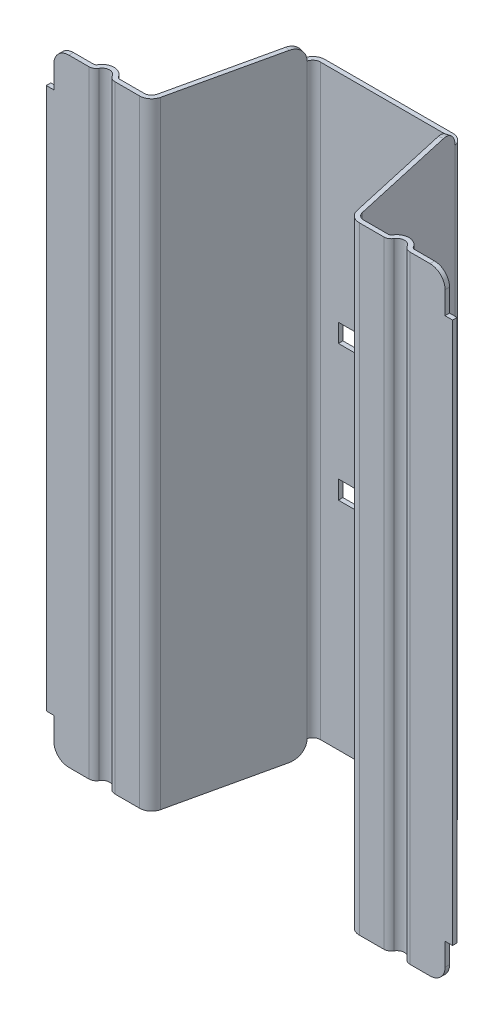
from build123d import *

# Parameters (mm, degrees)
EXTRUDE_THIN1_DEPTH = 20.5
EXTRUDE1_DEPTH      = 41
EXTRUDE2_DEPTH      = 1
FILLET1_R           = 1
EXTRUDE3_DEPTH      = 1
FILLET2_R           = 1
SKETCH5_W           = 6.1
SKETCH5_H           = 1.22
EXTRUDE4_DEPTH      = 45.5


with BuildPart() as part:
    # Sketch1 → Extrude-Thin1 (new, symmetric)
    with BuildSketch(Plane(origin=(0, 0, 0), x_dir=(1, 0, 0), z_dir=(0, 1, 0))):
        with BuildLine():
            Line((13.5, 0), (10.666025404, 0))
            ThreePointArc((10.666025404, 0), (10.416025404, 0.066987298), (10.233012702, 0.25))
            ThreePointArc((10.233012702, 0.25), (9.8, 0.5), (9.366987298, 0.25))
            ThreePointArc((9.366987298, 0.25), (9.183974596, 0.066987298), (8.933974596, 0))
            Line((8.933974596, 0), (7.3, 0))
            ThreePointArc((7.3, 0), (6.800019439, 0.175484637), (6.519386146, 0.624951403))
            Line((6.519386146, 0.624951403), (4.737883659, 8.569405373))
            ThreePointArc((4.737883659, 8.569405373), (4.56248785, 8.850322102), (4.25, 8.96))
            Line((4.25, 8.96), (-4.25, 8.96))
            ThreePointArc((-4.25, 8.96), (-4.56248785, 8.850322102), (-4.737883659, 8.569405373))
            Line((-4.737883659, 8.569405373), (-6.519386146, 0.624951403))
            ThreePointArc((-6.519386146, 0.624951403), (-6.800019439, 0.175484637), (-7.3, 0))
            Line((-7.3, 0), (-8.933974596, 0))
            ThreePointArc((-8.933974596, 0), (-9.183974596, 0.066987298), (-9.366987298, 0.25))
            ThreePointArc((-9.366987298, 0.25), (-9.8, 0.5), (-10.233012702, 0.25))
            ThreePointArc((-10.233012702, 0.25), (-10.416025404, 0.066987298), (-10.666025404, 0))
            Line((-10.666025404, 0), (-13.5, 0))
            Line((-13.5, 0), (-13.5, 0.3))
            Line((-13.5, 0.3), (-10.666025404, 0.3))
            ThreePointArc((-10.666025404, 0.3), (-10.566025404, 0.326794919), (-10.492820323, 0.4))
            ThreePointArc((-10.492820323, 0.4), (-9.8, 0.8), (-9.107179677, 0.4))
            ThreePointArc((-9.107179677, 0.4), (-9.033974596, 0.326794919), (-8.933974596, 0.3))
            Line((-8.933974596, 0.3), (-7.3, 0.3))
            ThreePointArc((-7.3, 0.3), (-6.98751215, 0.409677898), (-6.812116341, 0.690594627))
            Line((-6.812116341, 0.690594627), (-5.030613854, 8.635048597))
            ThreePointArc((-5.030613854, 8.635048597), (-4.749980561, 9.084515363), (-4.25, 9.26))
            Line((-4.25, 9.26), (4.25, 9.26))
            ThreePointArc((4.25, 9.26), (4.749980561, 9.084515363), (5.030613854, 8.635048597))
            Line((5.030613854, 8.635048597), (6.812116341, 0.690594627))
            ThreePointArc((6.812116341, 0.690594627), (6.98751215, 0.409677898), (7.3, 0.3))
            Line((7.3, 0.3), (8.933974596, 0.3))
            ThreePointArc((8.933974596, 0.3), (9.033974596, 0.326794919), (9.107179677, 0.4))
            ThreePointArc((9.107179677, 0.4), (9.8, 0.8), (10.492820323, 0.4))
            ThreePointArc((10.492820323, 0.4), (10.566025404, 0.326794919), (10.666025404, 0.3))
            Line((10.666025404, 0.3), (13.5, 0.3))
            Line((13.5, 0.3), (13.5, 0))
        make_face()
    extrude(amount=EXTRUDE_THIN1_DEPTH, both=True)

    # Sketch2 → Extrude1 (cut)
    with BuildSketch(Plane.XY):
        with BuildLine():
            Line((-13.5, 18), (-13, 18))
            Line((-13, 18), (-13, 19.5))
            ThreePointArc((-13, 19.5), (-12.707106781, 20.207106781), (-12, 20.5))
            Line((-12, 20.5), (0, 20.5))
            Line((0, 20.5), (12, 20.5))
            ThreePointArc((12, 20.5), (12.707106781, 20.207106781), (13, 19.5))
            Line((13, 19.5), (13, 18))
            Line((13, 18), (13.5, 18))
            Line((13.5, 18), (13.5, 21.5))
            Line((13.5, 21.5), (-13.5, 21.5))
            Line((-13.5, 21.5), (-13.5, 18))
        make_face()
        with BuildLine():
            Line((-13.5, -18), (-13, -18))
            Line((-13, -18), (-13, -19.5))
            ThreePointArc((-13, -19.5), (-12.707106781, -20.207106781), (-12, -20.5))
            Line((-12, -20.5), (12, -20.5))
            ThreePointArc((12, -20.5), (12.707106781, -20.207106781), (13, -19.5))
            Line((13, -19.5), (13, -18))
            Line((13, -18), (13.5, -18))
            Line((13.5, -18), (13.5, -21.5))
            Line((13.5, -21.5), (-13.5, -21.5))
            Line((-13.5, -21.5), (-13.5, -18))
        make_face()
    extrude(amount=-EXTRUDE1_DEPTH, mode=Mode.SUBTRACT)

    # Sketch3 → Extrude2 (cut)
    with BuildSketch(Plane(origin=(0, 20.5, 0), x_dir=(1, 0, 0), z_dir=(0, 1, 0))):
        Polygon((-5.030613854, 8.635048597), (-4.737883659, 8.569405373), (4.737883659, 8.569405373), (5.030613854, 8.635048597), (5.030613854, 9.569405373), (-5.030613854, 9.569405373), align=None)
    extrude(amount=-EXTRUDE2_DEPTH, mode=Mode.SUBTRACT)

    # Fillet1
    fillet1_edges = [part.edges().sort_by_distance(p)[0] for p in [
        (-4.884248756, 20.5, -8.602226985),
        (4.884248756, 20.5, -8.602226985),
    ]]
    fillet(fillet1_edges, radius=FILLET1_R - 0.0001)  # a hair under: the kernel refuses the full size

    # Sketch4 → Extrude3 (cut)
    with BuildSketch(Plane.XZ.offset(20.5)):
        Polygon((-4.737883659, -8.569405373), (-5.030613854, -8.635048597), (-5.030613854, -10.26), (5.030613854, -10.26), (5.030613854, -8.635048597), (4.737883659, -8.569405373), align=None)
    extrude(amount=-EXTRUDE3_DEPTH, mode=Mode.SUBTRACT)

    # Fillet2
    fillet2_edges = [part.edges().sort_by_distance(p)[0] for p in [
        (4.884248756, -20.5, -8.602226985),
        (-4.884248756, -20.5, -8.602226985),
    ]]
    fillet(fillet2_edges, radius=FILLET2_R - 0.0001)  # a hair under: the kernel refuses the full size

    # Sketch5 → Extrude4 (cut)
    with BuildSketch(Plane.XY):
        with Locations((0, 4.51)):
            Rectangle(SKETCH5_W, SKETCH5_H)
        with Locations((0, -4.51)):
            Rectangle(SKETCH5_W, SKETCH5_H)
    extrude(amount=-EXTRUDE4_DEPTH, mode=Mode.SUBTRACT)


solid = part.part
